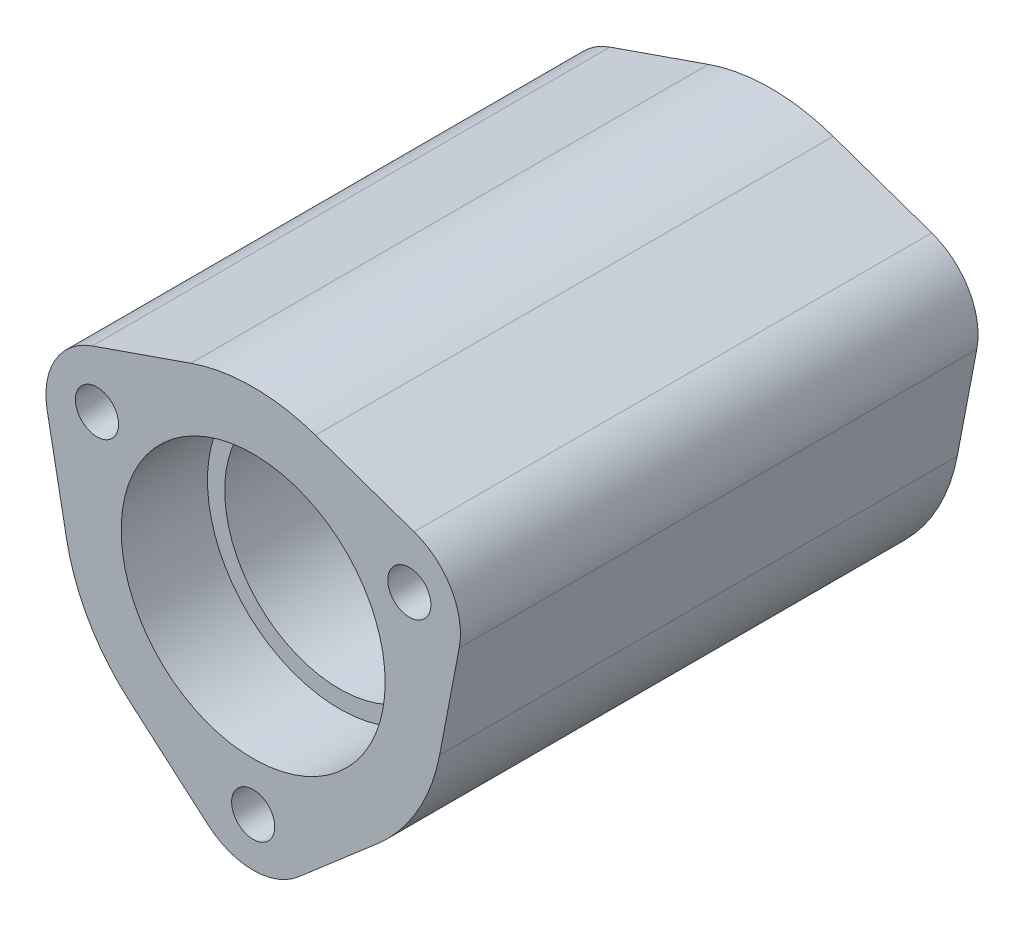
from build123d import *

# Parameters (mm, degrees)
EXTRUDE_758_DEPTH      = 15
EXTRUDE_758_DEPTH_BACK = 15
SKETCH_2_R             = 7.65
CUT_EXTRUDE_1096_DEPTH = 5
SKETCH_3_R             = 6.65
CUT_EXTRUDE_1238_DEPTH = 31.737928604
SKETCH_4_R             = 1.25
CUT_EXTRUDE_1729_DEPTH = 35.925925254


with BuildPart() as part:
    # Эскиз1 → Extrude 758 (new, two sides: drawn at the far end of the back side and taken through both)
    with BuildSketch(Plane.XY.offset(-EXTRUDE_758_DEPTH_BACK)):
        with BuildLine():
            Line((-9.32482414, 8.402984872), (-3.613745176, 10.389458398))
            ThreePointArc((-3.613745176, 10.389458398), (0, 11), (3.613745176, 10.389458398))
            Line((3.613745176, 10.389458398), (9.32482414, 8.402984872))
            ThreePointArc((9.32482414, 8.402984872), (11.4748366, 6.625), (11.939610437, 3.874042155))
            Line((11.939610437, 3.874042155), (10.804407492, -2.065134074))
            ThreePointArc((10.804407492, -2.065134074), (9.526279442, -5.5), (7.190662316, -8.324324324))
            Line((7.190662316, -8.324324324), (2.614786297, -12.277027027))
            ThreePointArc((2.614786297, -12.277027027), (0, -13.25), (-2.614786297, -12.277027027))
            Line((-2.614786297, -12.277027027), (-7.190662316, -8.324324324))
            ThreePointArc((-7.190662316, -8.324324324), (-9.526279442, -5.5), (-10.804407492, -2.065134074))
            Line((-10.804407492, -2.065134074), (-11.939610437, 3.874042155))
            ThreePointArc((-11.939610437, 3.874042155), (-11.4748366, 6.625), (-9.32482414, 8.402984872))
        make_face()
    extrude(amount=EXTRUDE_758_DEPTH + EXTRUDE_758_DEPTH_BACK)

    # Эскиз2 → Cut-Extrude 1096 (cut)
    with BuildSketch(Plane.XY.offset(15)):
        Circle(SKETCH_2_R)
    cut_extrude_1096 = extrude(amount=-CUT_EXTRUDE_1096_DEPTH, mode=Mode.SUBTRACT)

    # Mirror 1138: Cut-Extrude 1096 across plane
    add(cut_extrude_1096.mirror(Plane.XY), mode=Mode.SUBTRACT)

    # Эскиз3 → Cut-Extrude 1238 (cut, through all)
    with BuildSketch(Plane.XY.offset(10)):
        Circle(SKETCH_3_R)
    extrude(amount=-CUT_EXTRUDE_1238_DEPTH, mode=Mode.SUBTRACT)

    # Эскиз4 → Cut-Extrude 1729 (cut, through all)
    with BuildSketch(Plane.XY.offset(15)):
        with Locations((-9.04996547, 5.225)):
            Circle(SKETCH_4_R)
        with Locations((0, -10.45)):
            Circle(SKETCH_4_R)
        with Locations((9.04996547, 5.225)):
            Circle(SKETCH_4_R)
    extrude(amount=-CUT_EXTRUDE_1729_DEPTH, mode=Mode.SUBTRACT)


solid = part.part
